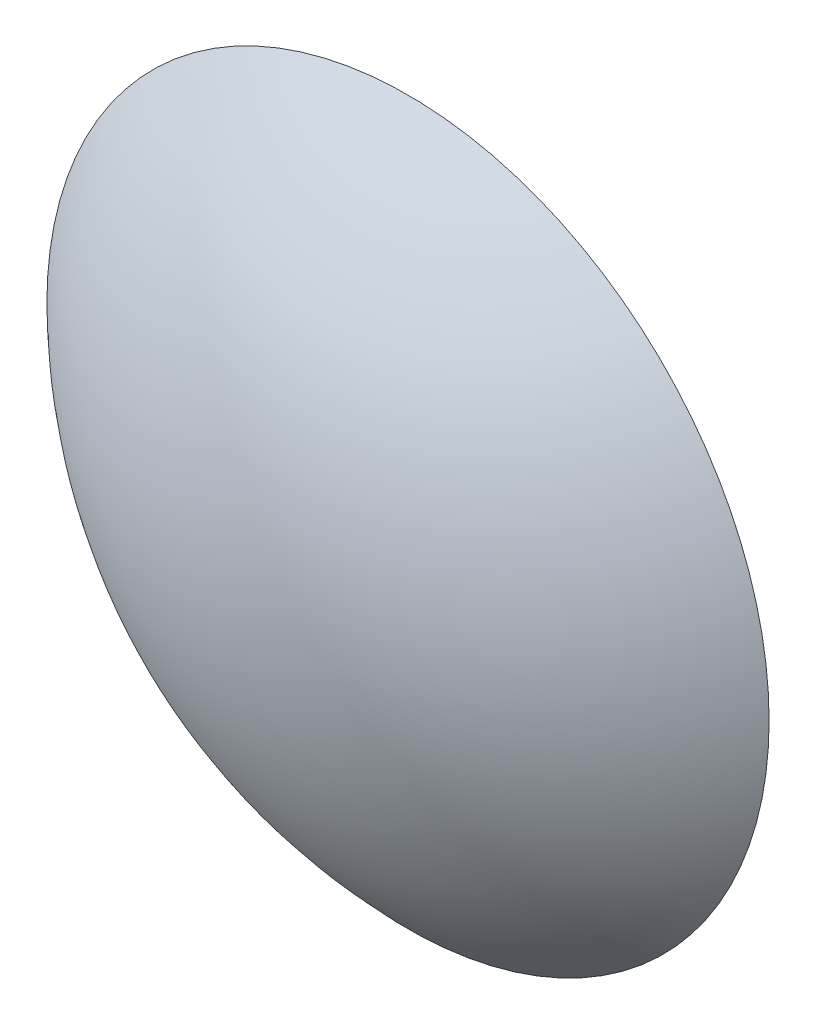
from build123d import *

# Parameters (mm, degrees)
SKETCH2_R                       = 50.9
SKETCH2_R_2                     = 46.9
BOSS_EXTRUDE1_DEPTH             = 5
BOSS_EXTRUDE1_DIRECTION_2_REACH = 90.882
THREAD1_PITCH                   = 2


with BuildPart() as part:
    # Sketch1 → Revolve1 (revolve)
    with BuildSketch(Plane(origin=(0, 0, 0), x_dir=(1, 0, 0), z_dir=(0, 1, 0))):
        with BuildLine():
            ThreePointArc((-61.23724357, -62.5), (-33.071891388, -81.00925873), (0, -87.5))
            Line((0, -87.5), (0, -83.5))
            ThreePointArc((0, -83.5), (-29.609964539, -78.073683146), (-55.3714728, -62.5))
            Line((-55.3714728, -62.5), (-61.23724357, -62.5))
        make_face()
    revolve(axis=Axis((0, 0, 87.5), (0, 0, -1)))

    # Sketch2 → Boss-Extrude1 (add)
    with BuildSketch(Plane(origin=(0, 0, 67.5), x_dir=(-1, 0, 0), z_dir=(0, 0, -1))):
        Circle(SKETCH2_R)
        Circle(SKETCH2_R_2, mode=Mode.SUBTRACT)
    extrude(amount=BOSS_EXTRUDE1_DEPTH)

    # Sketch2 → Boss-Extrude1 direction 2 (add, up to next)
    with BuildSketch(Plane(origin=(0, 0, 67.5), x_dir=(-1, 0, 0), z_dir=(0, 0, -1)), mode=Mode.PRIVATE) as boss_extrude1_direction_2_sk1:
        Circle(SKETCH2_R)
        Circle(SKETCH2_R_2, mode=Mode.SUBTRACT)
    boss_extrude1_direction_2_tool1 = extrude(boss_extrude1_direction_2_sk1.sketch, amount=-BOSS_EXTRUDE1_DIRECTION_2_REACH, mode=Mode.PRIVATE) - part.part
    add(boss_extrude1_direction_2_tool1.solids().sort_by_distance((49.460331, 0, 67.5))[0])

    # Thread1: arcs per turn and ends read off the stored shape
    # Thread1: the profile of Thread Profile1 profile screwed along a right-hand helix through 3.5 turns, 10 arcs to a turn; built about Z, then put on its axis
    thread1_z = Axis((0, 0, 0), (0, 0, 1))
    thread1_corners = [(-46.8997, 0, -7.000173205), (-47.711898812, 0, -6.531250002), (-47.711898812, 0, -6.343750002), (-46.8997, 0, -5.874826799)]
    with BuildLine(mode=Mode.PRIVATE) as thread1_profile:
        Line(thread1_corners[0], thread1_corners[1])
        Line(thread1_corners[1], thread1_corners[2])
        Line(thread1_corners[2], thread1_corners[3])
        Line(thread1_corners[3], thread1_corners[0])
    thread1_cap = Face(thread1_profile.wire())
    thread1_turn_angles = [0, 18, 36, 54, 72, 90, 108, 126, 144, 162, 180, 198, 216, 234, 252, 270, 288, 306, 324, 342, 360]
    thread1_turn_weights = [1, 0.9510565162951535, 1, 0.9510565162951535, 1, 0.9510565162951535, 1, 0.9510565162951535, 1, 0.9510565162951535, 1, 0.9510565162951535, 1, 0.9510565162951535, 1, 0.9510565162951535, 1, 0.9510565162951535, 1, 0.9510565162951535, 1]
    thread1_turn_rails = [Edge.make_bspline([Vector(p[0], p[1], 0).rotate(thread1_z, thread1_turn_angles[k]) / thread1_turn_weights[k] + Vector(0, 0, p[2] + THREAD1_PITCH * thread1_turn_angles[k] / 360) for k in range(21)], [0, 0, 0, 1, 1, 2, 2, 3, 3, 4, 4, 5, 5, 6, 6, 7, 7, 8, 8, 9, 9, 10, 10, 10], 2, thread1_turn_weights) for p in thread1_corners]
    thread1_turn_sides = [Face.make_surface_from_curves(thread1_turn_rails[p[0]], thread1_turn_rails[p[1]]) for p in [(0, 1), (1, 2), (2, 3), (3, 0)]]
    thread1_last_angles = [1080, 1098, 1116, 1134, 1152, 1170, 1188, 1206, 1224, 1242, 1260]
    thread1_last_weights = [1, 0.9510565162951535, 1, 0.9510565162951535, 1, 0.9510565162951535, 1, 0.9510565162951535, 1, 0.9510565162951535, 1]
    thread1_last_rails = [Edge.make_bspline([Vector(p[0], p[1], 0).rotate(thread1_z, thread1_last_angles[k]) / thread1_last_weights[k] + Vector(0, 0, p[2] + THREAD1_PITCH * thread1_last_angles[k] / 360) for k in range(11)], [0, 0, 0, 1, 1, 2, 2, 3, 3, 4, 4, 5, 5, 5], 2, thread1_last_weights) for p in thread1_corners]
    thread1_last_sides = [Face.make_surface_from_curves(thread1_last_rails[p[0]], thread1_last_rails[p[1]]) for p in [(0, 1), (1, 2), (2, 3), (3, 0)]]
    thread1 = Plane(origin=(0, 0, 62.5), x_dir=(1, 0, 0), z_dir=(0, 0, -1)) * Solid(Shell([*[p.moved(Location((0, 0, THREAD1_PITCH * i))) for i in range(3) for p in thread1_turn_sides], *thread1_last_sides, thread1_cap, thread1_cap.rotate(thread1_z, 1260).moved(Location((0, 0, THREAD1_PITCH * 1260 / 360)))]))
    add(thread1, mode=Mode.SUBTRACT)


solid = part.part
